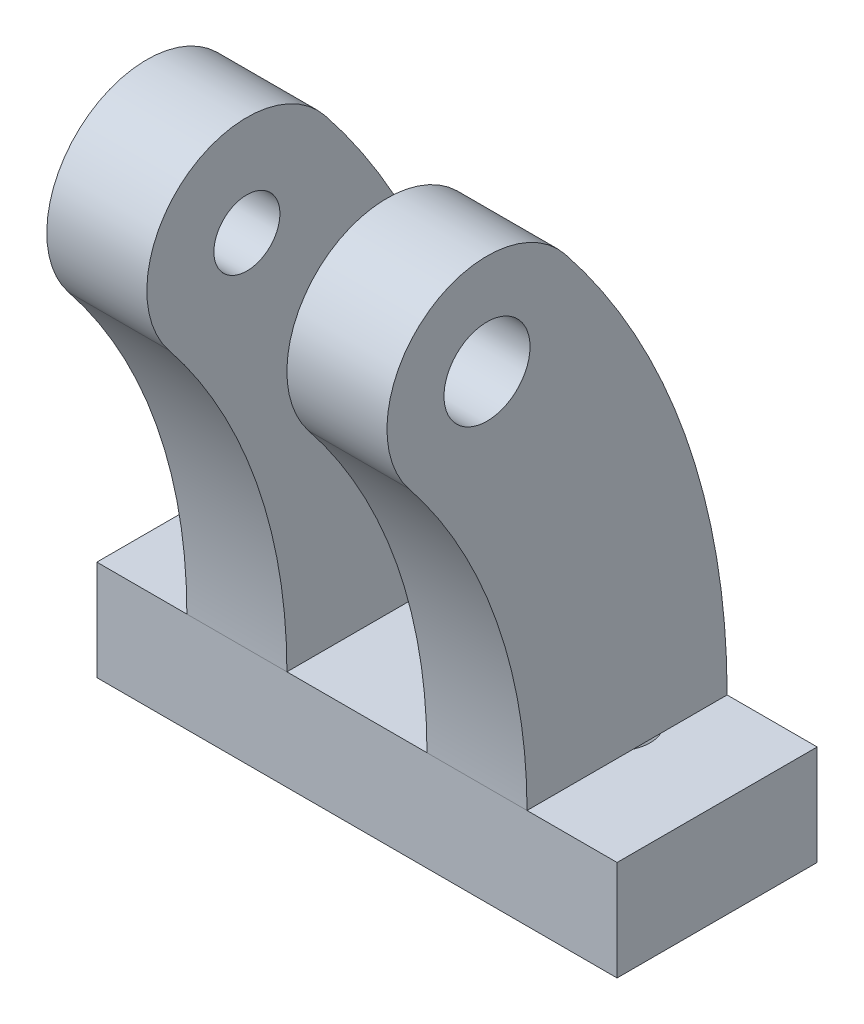
from build123d import *

# Parameters (mm, degrees)
SKETCH_1_W                   = 26
SKETCH_1_H                   = 10
EXTRUDE_1_DEPTH              = 5
EXTRUDE_START                = 3.5
EXTRUDE_2_DEPTH              = 5
HOLE_WIZARD_M4_1_REACH       = 37.089
HOLE_WIZARD_M4_1_BORE_R      = 2.15
HOLE_WIZARD_M4_1_2_OUTLINE_R = 1.65
HOLE_WIZARD_M4_1_2_DEPTH     = 5
HOLE_WIZARD_M4_2_D           = 3.3


# Read off the part's stored shape, not the designer's step: M4 螺纹孔1
with BuildPart() as part:
    # 草图1 → 凸台-拉伸1 (new body)
    with BuildSketch(Plane(origin=(0, 0, 0), x_dir=(1, 0, 0), z_dir=(0, 1, 0))):
        Rectangle(SKETCH_1_W, SKETCH_1_H)
    extrude(amount=EXTRUDE_1_DEPTH)

    # 草图2 → 凸台-拉伸2 (add)
    with BuildSketch(Plane(origin=(0, 0, 0), x_dir=(0, 0, -1), z_dir=(1, 0, 0)).offset(EXTRUDE_START)):
        with BuildLine():
            Line((-5, 5), (5, 5))
            ThreePointArc((5, 5), (2.918749068, 17.246562174), (-3.091314031, 28.118040089))
            ThreePointArc((-3.091314031, 28.118040089), (-10.118040089, 28.908685969), (-10.908685969, 21.881959911))
            ThreePointArc((-10.908685969, 21.881959911), (-6.519834496, 13.943057927), (-5, 5))
        make_face()
    extrude_2 = extrude(amount=EXTRUDE_2_DEPTH)

    # 镜向1: 凸台-拉伸2 across plane
    add(extrude_2.mirror(Plane(origin=(0, 0, 0), x_dir=(0, 0, 1), z_dir=(1, 0, 0))))

    # Hole Wizard M4 _1 bore (on position points) → Hole Wizard M4 _1 (cut, up to next)
    with BuildSketch(Plane(origin=(8.5, 25, 7), x_dir=(0, 0, 1), z_dir=(1, 0, 0)), mode=Mode.PRIVATE) as hole_wizard_m4_1_sk1:
        Circle(HOLE_WIZARD_M4_1_BORE_R)
    hole_wizard_m4_1_tool1 = extrude(hole_wizard_m4_1_sk1.sketch, amount=-HOLE_WIZARD_M4_1_REACH, mode=Mode.PRIVATE) & part.part
    add(hole_wizard_m4_1_tool1.solids().sort_by_distance((8.5, 25, 7))[0], mode=Mode.SUBTRACT)

    # Hole Wizard M4 _1 2 outline → Hole Wizard M4 _1 2 (cut)
    with BuildSketch(Plane(origin=(0, 0, 0), x_dir=(1, 0, 0), z_dir=(0, 1, 0))):
        with Locations((7, 1)):
            Circle(HOLE_WIZARD_M4_1_2_OUTLINE_R)
    extrude(amount=HOLE_WIZARD_M4_1_2_DEPTH, mode=Mode.SUBTRACT)

    # Hole Wizard M4 _1 2 2 outline → Hole Wizard M4 _1 2 2 (revolve, cut)
    with BuildSketch(Plane(origin=(-7, 0, -1), x_dir=(1, 0, 0), z_dir=(0, 0, 1))):
        Polygon((1.650000121, 4.999999927), (0, 5.991420021), (0, 0), (1.650000121, 0), align=None)
    revolve(axis=Axis((-7, 0, -1), (0, 1, 0)), mode=Mode.SUBTRACT)

    # M4 螺纹孔2 (through all)
    with Locations(Plane.ZY.offset(8.5)):
        with Locations((7, 25)):
            Hole(HOLE_WIZARD_M4_2_D / 2)


solid = part.part
